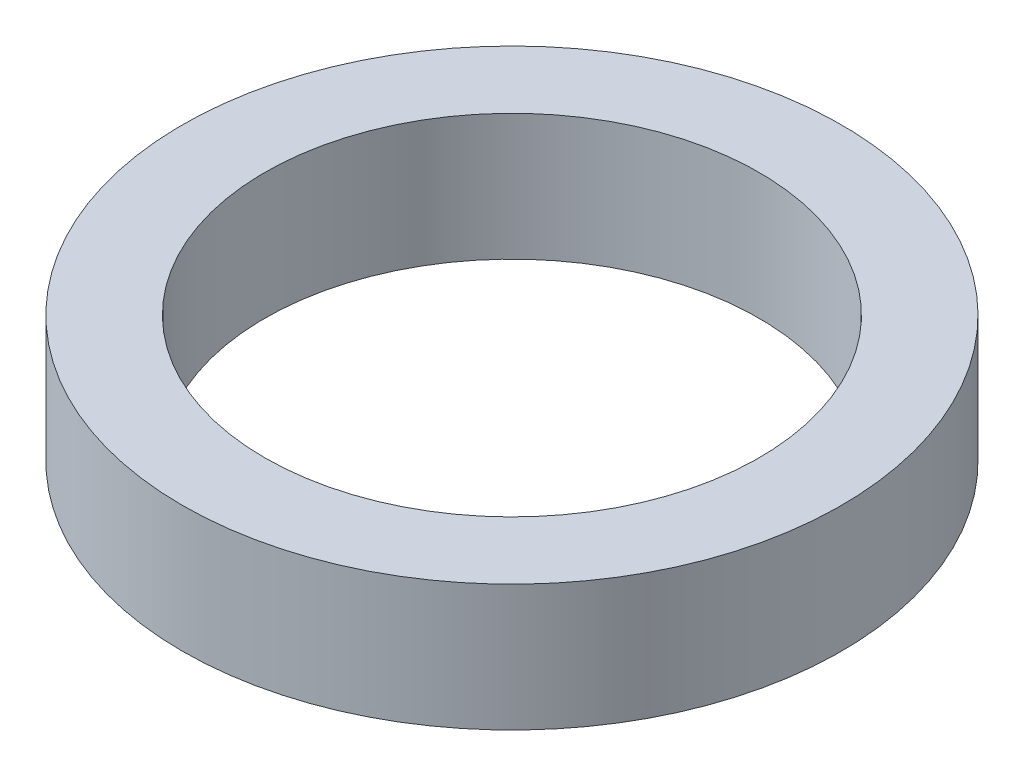
from build123d import *

# Parameters (mm, degrees)
SKETCH1_R           = 60
BOSS_EXTRUDE1_DEPTH = 23
SKETCH2_R           = 45
CUT_EXTRUDE1_DEPTH  = 88.914731416


with BuildPart() as part:
    # Sketch1 → Boss-Extrude1 (new body)
    with BuildSketch(Plane(origin=(0, 0, 0), x_dir=(1, 0, 0), z_dir=(0, 1, 0))):
        Circle(SKETCH1_R)
    extrude(amount=BOSS_EXTRUDE1_DEPTH)

    # Sketch2 → Cut-Extrude1 (cut, through all)
    with BuildSketch(Plane(origin=(0, 0, 0), x_dir=(1, 0, 0), z_dir=(0, 1, 0))):
        Circle(SKETCH2_R)
    extrude(amount=CUT_EXTRUDE1_DEPTH, mode=Mode.SUBTRACT)


solid = part.part
